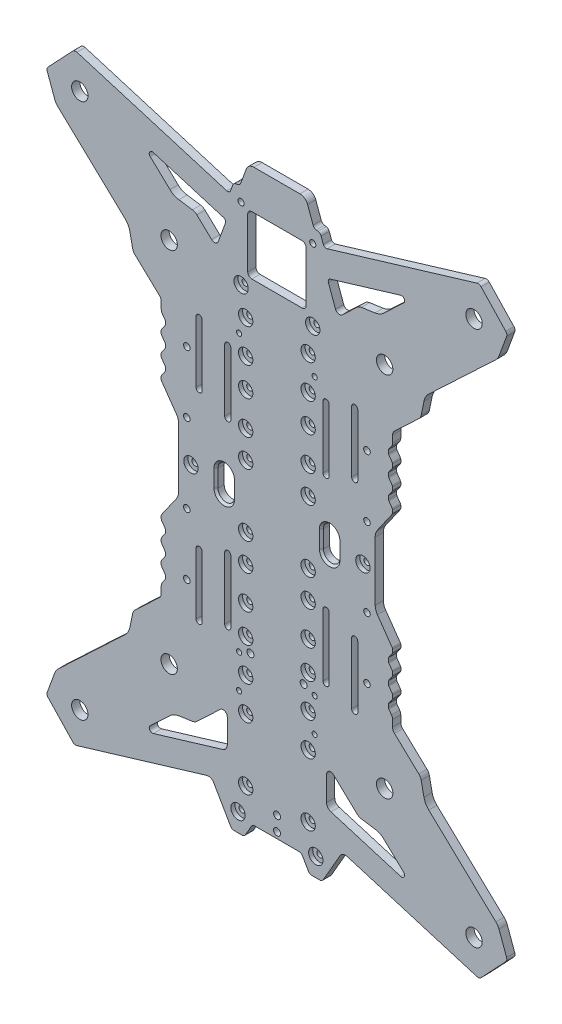
from build123d import *

# Parameters (mm, degrees)
MODEL_R                               = 1.5
MODEL_R_2                             = 4
MAIN_BODY_DEPTH                       = 4
LOWER_START                           = -2
SKETCH2_R                             = 3.5
SKETCH2_R_2                           = 1.5
LOWER_FIXTURE_POINT_COUNTERSINK_DEPTH = 2
EXTRA_BATTERY_STRAP_FIXTURES_REACH    = 419.565
BATTERY_CABLE_INGRESS_REACH           = 419.565
BATTERY_CABLE_INGRESS_CHAMFER_SIZE    = 1
MAUCH_PL200_MOUNTING_POINTS_REACH     = 419.565
SKETCH5_R                             = 1.25
RFD_CARRIER_MOUNTING_POINTS_REACH     = 419.565
SKETCH6_R                             = 1.700000001
ESC_CARRIER_FIXTURES_POINTS_REACH     = 419.565
SKETCH7_R                             = 1.6


with BuildPart() as part:
    # Model → Main Body (new body)
    with BuildSketch(Plane.XY):
        with BuildLine():
            Line((261.034392191, 314.782999023), (273.061648382, 302.032656534))
            ThreePointArc((273.061648382, 302.032656534), (273.565856978, 301.062828157), (273.484893514, 299.972764714))
            Line((273.484893514, 299.972764714), (269.784614814, 289.86483769))
            ThreePointArc((269.784614814, 289.86483769), (269.160003791, 288.625512695), (268.26736368, 287.562846704))
            Line((268.26736368, 287.562846704), (235.488392783, 256.642773314))
            ThreePointArc((235.488392783, 256.642773314), (233.992515204, 254.722726466), (233.143240584, 252.441726192))
            Line((233.143240584, 252.441726192), (231.792450322, 245.902694328))
            ThreePointArc((231.792450322, 245.902694328), (231.367815262, 244.762192559), (230.619877947, 243.802167042))
            Line((230.619877947, 243.802167042), (218.752224369, 232.607528134))
            ThreePointArc((218.752224369, 232.607528134), (218.056165205, 231.613589887), (217.810761554, 230.425234451))
            Line((217.810761554, 230.425234451), (217.810761554, 227.216127826))
            ThreePointArc((217.810761554, 227.216127826), (217.671912001, 226.314011906), (217.268217725, 225.495401336))
            Line((217.268217725, 225.495401336), (215.991609169, 223.672214462))
            ThreePointArc((215.991609169, 223.672214462), (215.857044411, 223.399344272), (215.810761226, 223.098638965))
            Line((215.810761226, 223.098638965), (215.810761226, 221.729233427))
            ThreePointArc((215.810761226, 221.729233427), (215.857044411, 221.428528121), (215.991609169, 221.155657931))
            Line((215.991609169, 221.155657931), (217.629913611, 218.815918578))
            ThreePointArc((217.629913611, 218.815918578), (217.76447837, 218.543048389), (217.810761554, 218.242343082))
            Line((217.810761554, 218.242343082), (217.810761554, 216.872937544))
            ThreePointArc((217.810761554, 216.872937544), (217.76447837, 216.572232237), (217.629913611, 216.299362047))
            Line((217.629913611, 216.299362047), (215.991609169, 213.959622695))
            ThreePointArc((215.991609169, 213.959622695), (215.857044411, 213.686752505), (215.810761226, 213.386047198))
            Line((215.810761226, 213.386047198), (215.810761226, 212.01664166))
            ThreePointArc((215.810761226, 212.01664166), (215.857044411, 211.715936353), (215.991609169, 211.443066163))
            Line((215.991609169, 211.443066163), (217.629913611, 209.103326811))
            ThreePointArc((217.629913611, 209.103326811), (217.76447837, 208.830456621), (217.810761554, 208.529751314))
            Line((217.810761554, 208.529751314), (217.810761554, 207.160345777))
            ThreePointArc((217.810761554, 207.160345777), (217.76447837, 206.85964047), (217.629913611, 206.58677028))
            Line((217.629913611, 206.58677028), (215.991609169, 204.247030927))
            ThreePointArc((215.991609169, 204.247030927), (215.85704385, 203.974158961), (215.810761226, 203.673451705))
            Line((215.810761226, 203.673451705), (215.810761226, 202.304049893))
            ThreePointArc((215.810761226, 202.304049893), (215.857044411, 202.003344586), (215.991609169, 201.730474396))
            Line((215.991609169, 201.730474396), (217.629913611, 199.390733181))
            ThreePointArc((217.629913611, 199.390733181), (217.76447837, 199.117862991), (217.810761554, 198.817157684))
            Line((217.810761554, 198.817157684), (217.810761554, 197.447755872))
            ThreePointArc((217.810761554, 197.447755872), (217.76447865, 197.147049591), (217.629913611, 196.874178513))
            Line((217.629913611, 196.874178513), (210.395850612, 186.542864455))
            ThreePointArc((210.395850612, 186.542864455), (209.588461221, 184.905640652), (209.310762955, 183.101405887))
            Line((209.310762955, 183.101405887), (209.310762955, 154.232495962))
            ThreePointArc((209.310762955, 154.232495962), (209.588461221, 152.428261198), (210.395850612, 150.791037394))
            Line((210.395850612, 150.791037394), (217.629913611, 140.459723337))
            ThreePointArc((217.629913611, 140.459723337), (217.76447865, 140.186852259), (217.810761554, 139.886145978))
            Line((217.810761554, 139.886145978), (217.810761554, 138.516744165))
            ThreePointArc((217.810761554, 138.516744165), (217.76447837, 138.216038858), (217.629913611, 137.943168669))
            Line((217.629913611, 137.943168669), (215.991609169, 135.603427453))
            ThreePointArc((215.991609169, 135.603427453), (215.857044411, 135.330557264), (215.810761226, 135.029851957))
            Line((215.810761226, 135.029851957), (215.810761226, 133.660450144))
            ThreePointArc((215.810761226, 133.660450144), (215.85704385, 133.359742889), (215.991609169, 133.086870922))
            Line((215.991609169, 133.086870922), (217.629913611, 130.74713157))
            ThreePointArc((217.629913611, 130.74713157), (217.76447837, 130.47426138), (217.810761554, 130.173556073))
            Line((217.810761554, 130.173556073), (217.810761554, 128.804150535))
            ThreePointArc((217.810761554, 128.804150535), (217.76447837, 128.503445228), (217.629913611, 128.230575039))
            Line((217.629913611, 128.230575039), (215.991609169, 125.890835686))
            ThreePointArc((215.991609169, 125.890835686), (215.857044411, 125.617965496), (215.810761226, 125.31726019))
            Line((215.810761226, 125.31726019), (215.810761226, 123.947854652))
            ThreePointArc((215.810761226, 123.947854652), (215.857044411, 123.647149345), (215.991609169, 123.374279155))
            Line((215.991609169, 123.374279155), (217.629913611, 121.034539803))
            ThreePointArc((217.629913611, 121.034539803), (217.76447837, 120.761669613), (217.810761554, 120.460964306))
            Line((217.810761554, 120.460964306), (217.810761554, 119.091558768))
            ThreePointArc((217.810761554, 119.091558768), (217.76447837, 118.790853461), (217.629913611, 118.517983271))
            Line((217.629913611, 118.517983271), (215.991609169, 116.178243919))
            ThreePointArc((215.991609169, 116.178243919), (215.857044411, 115.905373729), (215.810761226, 115.604668422))
            Line((215.810761226, 115.604668422), (215.810761226, 114.235262884))
            ThreePointArc((215.810761226, 114.235262884), (215.857044411, 113.934557578), (215.991609169, 113.661687388))
            Line((215.991609169, 113.661687388), (217.268217725, 111.838500513))
            ThreePointArc((217.268217725, 111.838500513), (217.671912001, 111.019889944), (217.810761554, 110.117774023))
            Line((217.810761554, 110.117774023), (217.810761554, 106.908667399))
            ThreePointArc((217.810761554, 106.908667399), (218.056165205, 105.720311962), (218.752224369, 104.726373716))
            Line((218.752224369, 104.726373716), (230.619877947, 93.531734808))
            ThreePointArc((230.619877947, 93.531734808), (231.367815262, 92.571709291), (231.792450322, 91.431207521))
            Line((231.792450322, 91.431207521), (233.143240584, 84.892175658))
            ThreePointArc((233.143240584, 84.892175658), (233.992515204, 82.611175384), (235.488392783, 80.691128536))
            Line((235.488392783, 80.691128536), (268.26736368, 49.771055146))
            ThreePointArc((268.26736368, 49.771055146), (269.160003791, 48.708389155), (269.784614814, 47.46906416))
            Line((269.784614814, 47.46906416), (273.484893514, 37.361137136))
            ThreePointArc((273.484893514, 37.361137136), (273.565856978, 36.271073693), (273.061648382, 35.301245315))
            Line((273.061648382, 35.301245315), (261.034392191, 22.550902827))
            ThreePointArc((261.034392191, 22.550902827), (260.095615458, 21.990999971), (259.002685917, 22.008262141))
            Line((259.002685917, 22.008262141), (195.639953388, 41.094414456))
            ThreePointArc((195.639953388, 41.094414456), (193.669430203, 41.010883841), (192.17661619, 39.721913202))
            Line((192.17661619, 39.721913202), (183.941960705, 25.45907305))
            ThreePointArc((183.941960705, 25.45907305), (183.209910003, 24.727020953), (182.209909333, 24.459071024))
            Line((182.209909333, 24.459071024), (178.411616383, 24.459071024))
            ThreePointArc((178.411616383, 24.459071024), (177.411615713, 24.727020953), (176.67956501, 25.45907305))
            Line((176.67956501, 25.45907305), (173.792813344, 30.459068282))
            ThreePointArc((173.792813344, 30.459068282), (173.060763045, 31.191120147), (172.060762902, 31.459070309))
            Line((172.060762902, 31.459070309), (150.560762172, 31.459070309))
            ThreePointArc((150.560762172, 31.459070309), (149.56076203, 31.191120147), (148.828711731, 30.459068282))
            Line((148.828711731, 30.459068282), (145.941960064, 25.45907305))
            ThreePointArc((145.941960064, 25.45907305), (145.209909362, 24.727020953), (144.209908692, 24.459071024))
            Line((144.209908692, 24.459071024), (140.411615742, 24.459071024))
            ThreePointArc((140.411615742, 24.459071024), (139.411615072, 24.727020953), (138.67956437, 25.45907305))
            Line((138.67956437, 25.45907305), (130.444908885, 39.721913202))
            ThreePointArc((130.444908885, 39.721913202), (128.952094872, 41.010883841), (126.981571687, 41.094414456))
            Line((126.981571687, 41.094414456), (63.618839157, 22.008262141))
            ThreePointArc((63.618839157, 22.008262141), (62.525909617, 21.990999971), (61.587132884, 22.550902827))
            Line((61.587132884, 22.550902827), (49.559876693, 35.301245315))
            ThreePointArc((49.559876693, 35.301245315), (49.055668097, 36.271073693), (49.136631561, 37.361137136))
            Line((49.136631561, 37.361137136), (52.836910261, 47.46906416))
            ThreePointArc((52.836910261, 47.46906416), (53.461521284, 48.708389155), (54.354161394, 49.771055146))
            Line((54.354161394, 49.771055146), (87.133132292, 80.691128536))
            ThreePointArc((87.133132292, 80.691128536), (88.629009871, 82.611175384), (89.478284491, 84.892175658))
            Line((89.478284491, 84.892175658), (90.829074753, 91.431207521))
            ThreePointArc((90.829074753, 91.431207521), (91.253709813, 92.571709291), (92.001647128, 93.531734808))
            Line((92.001647128, 93.531734808), (103.869300706, 104.726373716))
            ThreePointArc((103.869300706, 104.726373716), (104.565359869, 105.720311962), (104.810763521, 106.908667399))
            Line((104.810763521, 106.908667399), (104.810763521, 110.117774023))
            ThreePointArc((104.810763521, 110.117774023), (104.949613074, 111.019889944), (105.353307349, 111.838500513))
            Line((105.353307349, 111.838500513), (106.629915906, 113.661687388))
            ThreePointArc((106.629915906, 113.661687388), (106.764480664, 113.934557578), (106.810763849, 114.235262884))
            Line((106.810763849, 114.235262884), (106.810763849, 115.604668422))
            ThreePointArc((106.810763849, 115.604668422), (106.764480664, 115.905373729), (106.629915906, 116.178243919))
            Line((106.629915906, 116.178243919), (104.991611464, 118.517983271))
            ThreePointArc((104.991611464, 118.517983271), (104.857046705, 118.790853461), (104.810763521, 119.091558768))
            Line((104.810763521, 119.091558768), (104.810763521, 120.460964306))
            ThreePointArc((104.810763521, 120.460964306), (104.857046705, 120.761669613), (104.991611464, 121.034539803))
            Line((104.991611464, 121.034539803), (106.629915906, 123.374279155))
            ThreePointArc((106.629915906, 123.374279155), (106.764480664, 123.647149345), (106.810763849, 123.947854652))
            Line((106.810763849, 123.947854652), (106.810763849, 125.31726019))
            ThreePointArc((106.810763849, 125.31726019), (106.764480664, 125.617965496), (106.629915906, 125.890835686))
            Line((106.629915906, 125.890835686), (104.991611464, 128.230575039))
            ThreePointArc((104.991611464, 128.230575039), (104.857046705, 128.503445229), (104.810763521, 128.804150535))
            Line((104.810763521, 128.804150535), (104.810763521, 130.173556073))
            ThreePointArc((104.810763521, 130.173556073), (104.857046705, 130.47426138), (104.991611464, 130.74713157))
            Line((104.991611464, 130.74713157), (106.629915906, 133.086870922))
            ThreePointArc((106.629915906, 133.086870922), (106.764481224, 133.359742889), (106.810763849, 133.660450144))
            Line((106.810763849, 133.660450144), (106.810763849, 135.029851957))
            ThreePointArc((106.810763849, 135.029851957), (106.764480664, 135.330557264), (106.629915906, 135.603427453))
            Line((106.629915906, 135.603427453), (104.991611464, 137.943168669))
            ThreePointArc((104.991611464, 137.943168669), (104.857046705, 138.216038858), (104.810763521, 138.516744165))
            Line((104.810763521, 138.516744165), (104.810763521, 139.886145978))
            ThreePointArc((104.810763521, 139.886145978), (104.857046425, 140.186852259), (104.991611464, 140.459723337))
            Line((104.991611464, 140.459723337), (112.225674463, 150.791037394))
            ThreePointArc((112.225674463, 150.791037394), (113.033063854, 152.428261198), (113.31076212, 154.232495962))
            Line((113.31076212, 154.232495962), (113.31076212, 183.101405887))
            ThreePointArc((113.31076212, 183.101405887), (113.033063854, 184.905640652), (112.225674463, 186.542864455))
            Line((112.225674463, 186.542864455), (104.991611464, 196.874178513))
            ThreePointArc((104.991611464, 196.874178513), (104.857046425, 197.147049591), (104.810763521, 197.447755872))
            Line((104.810763521, 197.447755872), (104.810763521, 198.817157684))
            ThreePointArc((104.810763521, 198.817157684), (104.857046705, 199.117862991), (104.991611464, 199.390733181))
            Line((104.991611464, 199.390733181), (106.629915906, 201.730474396))
            ThreePointArc((106.629915906, 201.730474396), (106.764480664, 202.003344586), (106.810763849, 202.304049893))
            Line((106.810763849, 202.304049893), (106.810763849, 203.673451705))
            ThreePointArc((106.810763849, 203.673451705), (106.764481224, 203.974158961), (106.629915906, 204.247030927))
            Line((106.629915906, 204.247030927), (104.991611464, 206.58677028))
            ThreePointArc((104.991611464, 206.58677028), (104.857046705, 206.85964047), (104.810763521, 207.160345777))
            Line((104.810763521, 207.160345777), (104.810763521, 208.529751314))
            ThreePointArc((104.810763521, 208.529751314), (104.857046705, 208.830456621), (104.991611464, 209.103326811))
            Line((104.991611464, 209.103326811), (106.629915906, 211.443066163))
            ThreePointArc((106.629915906, 211.443066163), (106.764480664, 211.715936353), (106.810763849, 212.01664166))
            Line((106.810763849, 212.01664166), (106.810763849, 213.386047198))
            ThreePointArc((106.810763849, 213.386047198), (106.764480664, 213.686752505), (106.629915906, 213.959622695))
            Line((106.629915906, 213.959622695), (104.991611464, 216.299362047))
            ThreePointArc((104.991611464, 216.299362047), (104.857046705, 216.572232237), (104.810763521, 216.872937544))
            Line((104.810763521, 216.872937544), (104.810763521, 218.242343082))
            ThreePointArc((104.810763521, 218.242343082), (104.857046705, 218.543048389), (104.991611464, 218.815918578))
            Line((104.991611464, 218.815918578), (106.629915906, 221.155657931))
            ThreePointArc((106.629915906, 221.155657931), (106.764480664, 221.428528121), (106.810763849, 221.729233427))
            Line((106.810763849, 221.729233427), (106.810763849, 223.098638965))
            ThreePointArc((106.810763849, 223.098638965), (106.764480664, 223.399344272), (106.629915906, 223.672214462))
            Line((106.629915906, 223.672214462), (105.353307349, 225.495401336))
            ThreePointArc((105.353307349, 225.495401336), (104.949613074, 226.314011906), (104.810763521, 227.216127826))
            Line((104.810763521, 227.216127826), (104.810763521, 230.425234451))
            ThreePointArc((104.810763521, 230.425234451), (104.565359869, 231.613589887), (103.869300706, 232.607528134))
            Line((103.869300706, 232.607528134), (92.001647128, 243.802167042))
            ThreePointArc((92.001647128, 243.802167042), (91.253709813, 244.762192559), (90.829074753, 245.902694328))
            Line((90.829074753, 245.902694328), (89.478284491, 252.441726192))
            ThreePointArc((89.478284491, 252.441726192), (88.629009871, 254.722726466), (87.133132292, 256.642773314))
            Line((87.133132292, 256.642773314), (54.354161394, 287.562846704))
            ThreePointArc((54.354161394, 287.562846704), (53.461521284, 288.625512695), (52.836910261, 289.86483769))
            Line((52.836910261, 289.86483769), (49.136631561, 299.972764714))
            ThreePointArc((49.136631561, 299.972764714), (49.055668097, 301.062828157), (49.559876693, 302.032656534))
            Line((49.559876693, 302.032656534), (61.587132884, 314.782999023))
            ThreePointArc((61.587132884, 314.782999023), (62.525909617, 315.342901879), (63.618839157, 315.325639708))
            Line((63.618839157, 315.325639708), (136.809913812, 293.278984292))
            ThreePointArc((136.809913812, 293.278984292), (137.914608643, 293.374219842), (138.652082903, 294.202200635))
            Line((138.652082903, 294.202200635), (139.728013796, 297.158307894))
            ThreePointArc((139.728013796, 297.158307894), (140.321825305, 298.006352282), (141.260102762, 298.443875773))
            Line((141.260102762, 298.443875773), (142.112970723, 298.594258292))
            ThreePointArc((142.112970723, 298.594258292), (143.051251128, 299.031788099), (143.645059688, 299.879841073))
            Line((143.645059688, 299.879841073), (146.325001864, 307.242922051))
            ThreePointArc((146.325001864, 307.242922051), (147.789467359, 309.151448821), (150.083773209, 309.874839647))
            Line((150.083773209, 309.874839647), (172.537751866, 309.874839647))
            ThreePointArc((172.537751866, 309.874839647), (174.832057716, 309.151448821), (176.296523211, 307.242922051))
            Line((176.296523211, 307.242922051), (178.976465387, 299.879841073))
            ThreePointArc((178.976465387, 299.879841073), (179.570273946, 299.031788099), (180.508554352, 298.594258292))
            Line((180.508554352, 298.594258292), (181.361422313, 298.443875773))
            ThreePointArc((181.361422313, 298.443875773), (182.29969977, 298.006352282), (182.893511278, 297.158307894))
            Line((182.893511278, 297.158307894), (183.969442172, 294.202200635))
            ThreePointArc((183.969442172, 294.202200635), (184.706916432, 293.374219842), (185.811611263, 293.278984292))
            Line((185.811611263, 293.278984292), (259.002685917, 315.325639708))
            ThreePointArc((259.002685917, 315.325639708), (260.095615458, 315.342901879), (261.034392191, 314.782999023))
        make_face()
        with Locations((178.810762537, 292.022001283)):
            Circle(MODEL_R, mode=Mode.SUBTRACT)
        with Locations((213.945462155, 258.31672503)):
            Circle(MODEL_R_2, mode=Mode.SUBTRACT)
        with Locations((257.591400323, 299.487492346)):
            Circle(MODEL_R_2, mode=Mode.SUBTRACT)
        with Locations((65.030124751, 299.487492346)):
            Circle(MODEL_R_2, mode=Mode.SUBTRACT)
        with Locations((108.67606292, 258.31672503)):
            Circle(MODEL_R_2, mode=Mode.SUBTRACT)
        with Locations((108.67606292, 79.017176819)):
            Circle(MODEL_R_2, mode=Mode.SUBTRACT)
        with Locations((65.030124751, 37.846409503)):
            Circle(MODEL_R_2, mode=Mode.SUBTRACT)
        with Locations((257.591400323, 37.846409503)):
            Circle(MODEL_R_2, mode=Mode.SUBTRACT)
        with Locations((213.945462155, 79.017176819)):
            Circle(MODEL_R_2, mode=Mode.SUBTRACT)
        with Locations((143.810762537, 292.022001283)):
            Circle(MODEL_R, mode=Mode.SUBTRACT)
        with Locations((176.560762537, 227.916950925)):
            Circle(MODEL_R, mode=Mode.SUBTRACT)
        with Locations((146.060762537, 227.916950925)):
            Circle(MODEL_R, mode=Mode.SUBTRACT)
        with Locations((146.060762537, 123.541950925)):
            Circle(MODEL_R, mode=Mode.SUBTRACT)
        with Locations((176.560762537, 123.541950925)):
            Circle(MODEL_R, mode=Mode.SUBTRACT)
        with Locations((146.060762537, 93.041950925)):
            Circle(MODEL_R, mode=Mode.SUBTRACT)
        with Locations((176.560762537, 93.041950925)):
            Circle(MODEL_R, mode=Mode.SUBTRACT)
        with Locations((180.310762537, 33.459065681)):
            Circle(MODEL_R, mode=Mode.SUBTRACT)
        with Locations((142.310762537, 33.459065681)):
            Circle(MODEL_R, mode=Mode.SUBTRACT)
        with Locations((176.560762537, 76.666950925)):
            Circle(MODEL_R, mode=Mode.SUBTRACT)
        with Locations((146.060762537, 76.666950925)):
            Circle(MODEL_R, mode=Mode.SUBTRACT)
        with Locations((146.060762537, 109.416950925)):
            Circle(MODEL_R, mode=Mode.SUBTRACT)
        with Locations((119.310762537, 168.666950925)):
            Circle(MODEL_R, mode=Mode.SUBTRACT)
        with Locations((176.560762537, 139.916950925)):
            Circle(MODEL_R, mode=Mode.SUBTRACT)
        with Locations((146.060762537, 139.916950925)):
            Circle(MODEL_R, mode=Mode.SUBTRACT)
        with Locations((146.060762537, 213.791950925)):
            Circle(MODEL_R, mode=Mode.SUBTRACT)
        with Locations((176.560762537, 213.791950925)):
            Circle(MODEL_R, mode=Mode.SUBTRACT)
        with Locations((176.560762537, 109.416950925)):
            Circle(MODEL_R, mode=Mode.SUBTRACT)
        with Locations((176.560762537, 197.416950925)):
            Circle(MODEL_R, mode=Mode.SUBTRACT)
        with Locations((176.560762537, 244.291950925)):
            Circle(MODEL_R, mode=Mode.SUBTRACT)
        with Locations((203.310762537, 168.666950925)):
            Circle(MODEL_R, mode=Mode.SUBTRACT)
        with Locations((143.810762537, 257.022001283)):
            Circle(MODEL_R, mode=Mode.SUBTRACT)
        with Locations((178.810762537, 257.022001283)):
            Circle(MODEL_R, mode=Mode.SUBTRACT)
        with Locations((146.060762537, 244.291950925)):
            Circle(MODEL_R, mode=Mode.SUBTRACT)
        with Locations((146.060762537, 46.166950925)):
            Circle(MODEL_R, mode=Mode.SUBTRACT)
        with Locations((146.060762537, 197.416950925)):
            Circle(MODEL_R, mode=Mode.SUBTRACT)
        with Locations((176.560762537, 46.166950925)):
            Circle(MODEL_R, mode=Mode.SUBTRACT)
        with Locations((146.060762537, 183.916950925)):
            Circle(MODEL_R, mode=Mode.SUBTRACT)
        with Locations((146.060762537, 153.416950925)):
            Circle(MODEL_R, mode=Mode.SUBTRACT)
        with Locations((176.560762537, 153.416950925)):
            Circle(MODEL_R, mode=Mode.SUBTRACT)
        with Locations((176.560762537, 183.916950925)):
            Circle(MODEL_R, mode=Mode.SUBTRACT)
        with BuildLine():
            Line((183.810763431, 197.416951446), (183.810763431, 227.916951789))
            ThreePointArc((183.810763431, 227.916951789), (185.310762746, 229.416951104), (186.810762061, 227.916951789))
            Line((186.810762061, 227.916951789), (186.810762061, 197.416951446))
            ThreePointArc((186.810762061, 197.416951446), (185.310762746, 195.916952132), (183.810763431, 197.416951446))
        make_face(mode=Mode.SUBTRACT)
        with BuildLine():
            Line((138.810761643, 139.916950403), (138.810761643, 109.416950061))
            ThreePointArc((138.810761643, 109.416950061), (137.310762329, 107.916950746), (135.810763014, 109.416950061))
            Line((135.810763014, 109.416950061), (135.810763014, 139.916950403))
            ThreePointArc((135.810763014, 139.916950403), (137.310762329, 141.416949718), (138.810761643, 139.916950403))
        make_face(mode=Mode.SUBTRACT)
        with BuildLine():
            Line((186.810762061, 139.916950403), (186.810762061, 109.416950061))
            ThreePointArc((186.810762061, 109.416950061), (185.310762746, 107.916950746), (183.810763431, 109.416950061))
            Line((183.810763431, 109.416950061), (183.810763431, 139.916950403))
            ThreePointArc((183.810763431, 139.916950403), (185.310762746, 141.416949718), (186.810762061, 139.916950403))
        make_face(mode=Mode.SUBTRACT)
        with BuildLine():
            Line((135.810763014, 197.416951446), (135.810763014, 227.916951789))
            ThreePointArc((135.810763014, 227.916951789), (137.310762329, 229.416951104), (138.810761643, 227.916951789))
            Line((138.810761643, 227.916951789), (138.810761643, 197.416951446))
            ThreePointArc((138.810761643, 197.416951446), (137.310762329, 195.916952132), (135.810763014, 197.416951446))
        make_face(mode=Mode.SUBTRACT)
        with BuildLine():
            Line((147.06076253, 264.094478949), (147.06076253, 288.594476445))
            ThreePointArc((147.06076253, 288.594476445), (147.646550285, 290.008687927), (149.060762858, 290.594473048))
            Line((149.060762858, 290.594473048), (173.560762217, 290.594473048))
            ThreePointArc((173.560762217, 290.594473048), (174.97497479, 290.008687927), (175.560762545, 288.594476445))
            Line((175.560762545, 288.594476445), (175.560762545, 264.094478949))
            ThreePointArc((175.560762545, 264.094478949), (174.974977424, 262.68026265), (173.560762217, 262.094474896))
            Line((173.560762217, 262.094474896), (149.060762858, 262.094474896))
            ThreePointArc((149.060762858, 262.094474896), (147.646547651, 262.68026265), (147.06076253, 264.094478949))
        make_face(mode=Mode.SUBTRACT)
        with BuildLine():
            Line((133.688403664, 72.367697521), (122.193541748, 61.524711116))
            ThreePointArc((122.193541748, 61.524711116), (121.191534815, 60.834033021), (120.028213037, 60.476630493))
            Line((120.028213037, 60.476630493), (113.421537353, 59.509470625))
            ThreePointArc((113.421537353, 59.509470625), (111.094892422, 58.79465859), (109.09087993, 57.413294478))
            Line((109.09087993, 57.413294478), (99.422797931, 48.293493255))
            ThreePointArc((99.422797931, 48.293493255), (99.153636079, 46.451307287), (100.884698702, 45.766092403))
            Line((100.884698702, 45.766092403), (134.92602147, 56.020035906))
            ThreePointArc((134.92602147, 56.020035906), (136.468642418, 57.103103666), (137.060761822, 58.892547651))
            Line((137.060761822, 58.892547651), (137.060761822, 70.912830098))
            ThreePointArc((137.060761822, 70.912830098), (135.85300129, 72.749229936), (133.688403664, 72.367697521))
        make_face(mode=Mode.SUBTRACT)
        with BuildLine():
            Line((209.199987722, 59.509470625), (202.593312038, 60.476630493))
            ThreePointArc((202.593312038, 60.476630493), (201.42999026, 60.834033021), (200.427983327, 61.524711116))
            Line((200.427983327, 61.524711116), (188.933121411, 72.367697521))
            ThreePointArc((188.933121411, 72.367697521), (186.768523785, 72.749229936), (185.560763253, 70.912830098))
            Line((185.560763253, 70.912830098), (185.560763253, 58.892547651))
            ThreePointArc((185.560763253, 58.892547651), (186.152882656, 57.103103666), (187.695503605, 56.020035906))
            Line((187.695503605, 56.020035906), (221.736826373, 45.766092403))
            ThreePointArc((221.736826373, 45.766092403), (223.467888996, 46.451307287), (223.198727144, 48.293493255))
            Line((223.198727144, 48.293493255), (213.530645145, 57.413294478))
            ThreePointArc((213.530645145, 57.413294478), (211.526632653, 58.79465859), (209.199987722, 59.509470625))
        make_face(mode=Mode.SUBTRACT)
        with BuildLine():
            Line((113.421537353, 277.824431224), (120.028213037, 276.857271357))
            ThreePointArc((120.028213037, 276.857271357), (121.191534815, 276.499868829), (122.193541748, 275.809190734))
            Line((122.193541748, 275.809190734), (129.428796841, 268.98424284))
            ThreePointArc((129.428796841, 268.98424284), (131.262472413, 268.49303928), (132.680541275, 269.755072458))
            Line((132.680541275, 269.755072458), (136.150926722, 279.289878471))
            ThreePointArc((136.150926722, 279.289878471), (136.082401816, 280.474972249), (135.17401777, 281.239158972))
            Line((135.17401777, 281.239158972), (100.884698702, 291.567809446))
            ThreePointArc((100.884698702, 291.567809446), (99.153636079, 290.882594562), (99.422797931, 289.040408595))
            Line((99.422797931, 289.040408595), (109.09087993, 279.920607372))
            ThreePointArc((109.09087993, 279.920607372), (111.094892422, 278.539243259), (113.421537353, 277.824431224))
        make_face(mode=Mode.SUBTRACT)
        with BuildLine():
            Line((193.192728234, 268.98424284), (200.427983327, 275.809190734))
            ThreePointArc((200.427983327, 275.809190734), (201.42999026, 276.499868829), (202.593312038, 276.857271357))
            Line((202.593312038, 276.857271357), (209.199987722, 277.824431224))
            ThreePointArc((209.199987722, 277.824431224), (211.526632653, 278.539243259), (213.530645145, 279.920607372))
            Line((213.530645145, 279.920607372), (223.198727144, 289.040408595))
            ThreePointArc((223.198727144, 289.040408595), (223.467888996, 290.882594562), (221.736826373, 291.567809446))
            Line((221.736826373, 291.567809446), (187.447507305, 281.239158972))
            ThreePointArc((187.447507305, 281.239158972), (186.539123259, 280.474972249), (186.470598353, 279.289878471))
            Line((186.470598353, 279.289878471), (189.9409838, 269.755072458))
            ThreePointArc((189.9409838, 269.755072458), (191.359052662, 268.49303928), (193.192728234, 268.98424284))
        make_face(mode=Mode.SUBTRACT)
    extrude(amount=MAIN_BODY_DEPTH)

    # Sketch2 → Lower Fixture Point Countersink (cut)
    # profile 1 of 30: a face of its own
    with BuildSketch(Plane.XY.offset(4).offset(LOWER_START)):
        with Locations((176.560762537, 46.166950925)):
            Circle(SKETCH2_R)
    # profile 2 of 30: a face of its own
    with BuildSketch(Plane.XY.offset(4).offset(LOWER_START)):
        with Locations((180.310762537, 33.459065681)):
            Circle(SKETCH2_R)
    # profile 3 of 30: a face of its own
    with BuildSketch(Plane.XY.offset(4).offset(LOWER_START)):
        with Locations((142.310762537, 33.459065681)):
            Circle(SKETCH2_R)
    # profile 4 of 30: a face of its own
    with BuildSketch(Plane.XY.offset(4).offset(LOWER_START)):
        with Locations((146.060762537, 46.166950925)):
            Circle(SKETCH2_R)
    # profile 5 of 30: a face of its own
    with BuildSketch(Plane.XY.offset(4).offset(LOWER_START)):
        with Locations((176.560762537, 76.666950925)):
            Circle(SKETCH2_R)
    # profile 6 of 30: a face of its own
    with BuildSketch(Plane.XY.offset(4).offset(LOWER_START)):
        with Locations((146.060762537, 76.666950925)):
            Circle(SKETCH2_R)
    # profile 7 of 30: a face of its own
    with BuildSketch(Plane.XY.offset(4).offset(LOWER_START)):
        with Locations((146.060762537, 93.041950925)):
            Circle(SKETCH2_R)
    # profile 8 of 30: a face of its own
    with BuildSketch(Plane.XY.offset(4).offset(LOWER_START)):
        with Locations((176.560762537, 93.041950925)):
            Circle(SKETCH2_R)
    # profile 9 of 30: a face of its own
    with BuildSketch(Plane.XY.offset(4).offset(LOWER_START)):
        with Locations((176.560762537, 109.416950925)):
            Circle(SKETCH2_R)
    # profile 10 of 30: a face of its own
    with BuildSketch(Plane.XY.offset(4).offset(LOWER_START)):
        with Locations((146.060762537, 109.416950925)):
            Circle(SKETCH2_R)
    # profile 11 of 30: a face of its own
    with BuildSketch(Plane.XY.offset(4).offset(LOWER_START)):
        with Locations((176.560762537, 123.541950925)):
            Circle(SKETCH2_R)
    # profile 12 of 30: a face of its own
    with BuildSketch(Plane.XY.offset(4).offset(LOWER_START)):
        with Locations((146.060762537, 123.541950925)):
            Circle(SKETCH2_R)
    # profile 13 of 30: a face of its own
    with BuildSketch(Plane.XY.offset(4).offset(LOWER_START)):
        with Locations((146.060762537, 139.916950925)):
            Circle(SKETCH2_R)
    # profile 14 of 30: a face of its own
    with BuildSketch(Plane.XY.offset(4).offset(LOWER_START)):
        with Locations((176.560762537, 139.916950925)):
            Circle(SKETCH2_R)
        with Locations((176.560762537, 139.916950925)):
            Circle(SKETCH2_R_2, mode=Mode.SUBTRACT)
    # profile 15 of 30: a face of its own
    with BuildSketch(Plane.XY.offset(4).offset(LOWER_START)):
        with Locations((203.310762537, 168.666950925)):
            Circle(SKETCH2_R)
    # profile 16 of 30: a face of its own
    with BuildSketch(Plane.XY.offset(4).offset(LOWER_START)):
        with Locations((176.560762537, 153.416950925)):
            Circle(SKETCH2_R)
    # profile 17 of 30: a face of its own
    with BuildSketch(Plane.XY.offset(4).offset(LOWER_START)):
        with Locations((146.060762537, 153.416950925)):
            Circle(SKETCH2_R)
    # profile 18 of 30: a face of its own
    with BuildSketch(Plane.XY.offset(4).offset(LOWER_START)):
        with Locations((119.310762537, 168.666950925)):
            Circle(SKETCH2_R)
    # profile 19 of 30: a face of its own
    with BuildSketch(Plane.XY.offset(4).offset(LOWER_START)):
        with Locations((146.060762537, 183.916950925)):
            Circle(SKETCH2_R)
    # profile 20 of 30: a face of its own
    with BuildSketch(Plane.XY.offset(4).offset(LOWER_START)):
        with Locations((176.560762537, 183.916950925)):
            Circle(SKETCH2_R)
    # profile 21 of 30: a face of its own
    with BuildSketch(Plane.XY.offset(4).offset(LOWER_START)):
        with Locations((176.560762537, 197.416950925)):
            Circle(SKETCH2_R)
    # profile 22 of 30: a face of its own
    with BuildSketch(Plane.XY.offset(4).offset(LOWER_START)):
        with Locations((146.060762537, 197.416950925)):
            Circle(SKETCH2_R)
    # profile 23 of 30: a face of its own
    with BuildSketch(Plane.XY.offset(4).offset(LOWER_START)):
        with Locations((176.560762537, 213.791950925)):
            Circle(SKETCH2_R)
    # profile 24 of 30: a face of its own
    with BuildSketch(Plane.XY.offset(4).offset(LOWER_START)):
        with Locations((146.060762537, 213.791950925)):
            Circle(SKETCH2_R)
    # profile 25 of 30: a face of its own
    with BuildSketch(Plane.XY.offset(4).offset(LOWER_START)):
        with Locations((146.060762537, 227.916950925)):
            Circle(SKETCH2_R)
    # profile 26 of 30: a face of its own
    with BuildSketch(Plane.XY.offset(4).offset(LOWER_START)):
        with Locations((176.560762537, 227.916950925)):
            Circle(SKETCH2_R)
    # profile 27 of 30: a face of its own
    with BuildSketch(Plane.XY.offset(4).offset(LOWER_START)):
        with Locations((176.560762537, 244.291950925)):
            Circle(SKETCH2_R)
    # profile 28 of 30: a face of its own
    with BuildSketch(Plane.XY.offset(4).offset(LOWER_START)):
        with Locations((178.810762537, 257.022001283)):
            Circle(SKETCH2_R)
    # profile 29 of 30: a face of its own
    with BuildSketch(Plane.XY.offset(4).offset(LOWER_START)):
        with Locations((146.060762537, 244.291950925)):
            Circle(SKETCH2_R)
    # profile 30 of 30: a face of its own
    with BuildSketch(Plane.XY.offset(4).offset(LOWER_START)):
        with Locations((143.810762537, 257.022001283)):
            Circle(SKETCH2_R)
    extrude(amount=LOWER_FIXTURE_POINT_COUNTERSINK_DEPTH, mode=Mode.SUBTRACT)

    # Sketch3 → Extra Battery Strap Fixtures (cut, up to next)
    with BuildSketch(Plane(origin=(0, 0, 0), x_dir=(-1, 0, 0), z_dir=(0, 0, -1)), mode=Mode.PRIVATE) as extra_battery_strap_fixtures_sk1:
        with BuildLine():
            Line((-124.810763074, 134.666949077), (-124.810763074, 104.666947885))
            ThreePointArc((-124.810763074, 104.666947885), (-123.310761897, 103.166946708), (-121.81076072, 104.666947885))
            Line((-121.81076072, 104.666947885), (-121.81076072, 134.666949077))
            ThreePointArc((-121.81076072, 134.666949077), (-123.310761897, 136.166950254), (-124.810763074, 134.666949077))
        make_face()
    extra_battery_strap_fixtures_tool1 = extrude(extra_battery_strap_fixtures_sk1.sketch, amount=-EXTRA_BATTERY_STRAP_FIXTURES_REACH, mode=Mode.PRIVATE) & part.part
    # Sketch3 → Extra Battery Strap Fixtures (cut, up to next)
    with BuildSketch(Plane(origin=(0, 0, 0), x_dir=(-1, 0, 0), z_dir=(0, 0, -1)), mode=Mode.PRIVATE) as extra_battery_strap_fixtures_sk2:
        with BuildLine():
            Line((-124.810763074, 232.666953965), (-124.810763074, 202.666952773))
            ThreePointArc((-124.810763074, 202.666952773), (-123.310761897, 201.166951595), (-121.81076072, 202.666952773))
            Line((-121.81076072, 202.666952773), (-121.81076072, 232.666953965))
            ThreePointArc((-121.81076072, 232.666953965), (-123.310761897, 234.166955142), (-124.810763074, 232.666953965))
        make_face()
    extra_battery_strap_fixtures_tool2 = extrude(extra_battery_strap_fixtures_sk2.sketch, amount=-EXTRA_BATTERY_STRAP_FIXTURES_REACH, mode=Mode.PRIVATE) & part.part
    # Sketch3 → Extra Battery Strap Fixtures (cut, up to next)
    with BuildSketch(Plane(origin=(0, 0, 0), x_dir=(-1, 0, 0), z_dir=(0, 0, -1)), mode=Mode.PRIVATE) as extra_battery_strap_fixtures_sk3:
        with BuildLine():
            Line((-200.810764355, 232.666953965), (-200.810764355, 202.666952773))
            ThreePointArc((-200.810764355, 202.666952773), (-199.310763178, 201.166951595), (-197.810762001, 202.666952773))
            Line((-197.810762001, 202.666952773), (-197.810762001, 232.666953965))
            ThreePointArc((-197.810762001, 232.666953965), (-199.310763178, 234.166955142), (-200.810764355, 232.666953965))
        make_face()
    extra_battery_strap_fixtures_tool3 = extrude(extra_battery_strap_fixtures_sk3.sketch, amount=-EXTRA_BATTERY_STRAP_FIXTURES_REACH, mode=Mode.PRIVATE) & part.part
    # Sketch3 → Extra Battery Strap Fixtures (cut, up to next)
    with BuildSketch(Plane(origin=(0, 0, 0), x_dir=(-1, 0, 0), z_dir=(0, 0, -1)), mode=Mode.PRIVATE) as extra_battery_strap_fixtures_sk4:
        with BuildLine():
            Line((-197.810762001, 104.666947885), (-197.810762001, 134.666949077))
            ThreePointArc((-197.810762001, 134.666949077), (-199.310763178, 136.166950254), (-200.810764355, 134.666949077))
            Line((-200.810764355, 134.666949077), (-200.810764355, 104.666947885))
            ThreePointArc((-200.810764355, 104.666947885), (-199.310763178, 103.166946708), (-197.810762001, 104.666947885))
        make_face()
    extra_battery_strap_fixtures_tool4 = extrude(extra_battery_strap_fixtures_sk4.sketch, amount=-EXTRA_BATTERY_STRAP_FIXTURES_REACH, mode=Mode.PRIVATE) & part.part
    add(extra_battery_strap_fixtures_tool1.solids().sort_by_distance((123.310762, 119.666948, 0))[0], mode=Mode.SUBTRACT)
    add(extra_battery_strap_fixtures_tool2.solids().sort_by_distance((123.310762, 217.666953, 0))[0], mode=Mode.SUBTRACT)
    add(extra_battery_strap_fixtures_tool3.solids().sort_by_distance((199.310763, 217.666953, 0))[0], mode=Mode.SUBTRACT)
    add(extra_battery_strap_fixtures_tool4.solids().sort_by_distance((199.310763, 119.666948, 0))[0], mode=Mode.SUBTRACT)

    # Sketch4 → Battery Cable Ingress (cut, up to next)
    with BuildSketch(Plane(origin=(0, 0, 0), x_dir=(-1, 0, 0), z_dir=(0, 0, -1)), mode=Mode.PRIVATE) as battery_cable_ingress_sk1:
        with BuildLine():
            Line((-191.060763257, 164.416950065), (-191.060763257, 172.916950065))
            ThreePointArc((-191.060763257, 172.916950065), (-187.060763257, 176.916950065), (-183.060763257, 172.916950065))
            Line((-183.060763257, 172.916950065), (-183.060763257, 164.416950065))
            ThreePointArc((-183.060763257, 164.416950065), (-187.060763257, 160.416950065), (-191.060763257, 164.416950065))
        make_face()
    battery_cable_ingress_tool1 = extrude(battery_cable_ingress_sk1.sketch, amount=-BATTERY_CABLE_INGRESS_REACH, mode=Mode.PRIVATE) & part.part
    # Sketch4 → Battery Cable Ingress (cut, up to next)
    with BuildSketch(Plane(origin=(0, 0, 0), x_dir=(-1, 0, 0), z_dir=(0, 0, -1)), mode=Mode.PRIVATE) as battery_cable_ingress_sk2:
        with BuildLine():
            Line((-131.560763257, 172.916950065), (-131.560763257, 164.416950065))
            ThreePointArc((-131.560763257, 164.416950065), (-135.560763257, 160.416950065), (-139.560763257, 164.416950065))
            Line((-139.560763257, 164.416950065), (-139.560763257, 172.916950065))
            ThreePointArc((-139.560763257, 172.916950065), (-135.560763257, 176.916950065), (-131.560763257, 172.916950065))
        make_face()
    battery_cable_ingress_tool2 = extrude(battery_cable_ingress_sk2.sketch, amount=-BATTERY_CABLE_INGRESS_REACH, mode=Mode.PRIVATE) & part.part
    add(battery_cable_ingress_tool1.solids().sort_by_distance((187.060763, 168.66695, 0))[0], mode=Mode.SUBTRACT)
    add(battery_cable_ingress_tool2.solids().sort_by_distance((135.560763, 168.66695, 0))[0], mode=Mode.SUBTRACT)

    # Battery Cable Ingress Chamfer
    battery_cable_ingress_chamfer_edges = [part.edges().sort_by_distance(p)[0] for p in [
        (131.560763257, 168.666950065, 4),
        (139.560763257, 168.666950065, 4),
        (183.060763257, 168.666950065, 4),
        (191.060763257, 168.666950065, 4),
    ]]
    chamfer(battery_cable_ingress_chamfer_edges, length=BATTERY_CABLE_INGRESS_CHAMFER_SIZE)

    # Sketch5 → Mauch PL200 Mounting Points (cut, up to next)
    with BuildSketch(Plane(origin=(0, 0, 0), x_dir=(-1, 0, 0), z_dir=(0, 0, -1)), mode=Mode.PRIVATE) as mauch_pl200_mounting_points_sk1:
        with Locations((-142.860762537, 84.854450925)):
            Circle(SKETCH5_R)
    mauch_pl200_mounting_points_tool1 = extrude(mauch_pl200_mounting_points_sk1.sketch, amount=-MAUCH_PL200_MOUNTING_POINTS_REACH, mode=Mode.PRIVATE) & part.part
    # Sketch5 → Mauch PL200 Mounting Points (cut, up to next)
    with BuildSketch(Plane(origin=(0, 0, 0), x_dir=(-1, 0, 0), z_dir=(0, 0, -1)), mode=Mode.PRIVATE) as mauch_pl200_mounting_points_sk2:
        with Locations((-142.860762537, 101.229450925)):
            Circle(SKETCH5_R)
    mauch_pl200_mounting_points_tool2 = extrude(mauch_pl200_mounting_points_sk2.sketch, amount=-MAUCH_PL200_MOUNTING_POINTS_REACH, mode=Mode.PRIVATE) & part.part
    # Sketch5 → Mauch PL200 Mounting Points (cut, up to next)
    with BuildSketch(Plane(origin=(0, 0, 0), x_dir=(-1, 0, 0), z_dir=(0, 0, -1)), mode=Mode.PRIVATE) as mauch_pl200_mounting_points_sk3:
        with Locations((-142.860762537, 236.104450925)):
            Circle(SKETCH5_R)
    mauch_pl200_mounting_points_tool3 = extrude(mauch_pl200_mounting_points_sk3.sketch, amount=-MAUCH_PL200_MOUNTING_POINTS_REACH, mode=Mode.PRIVATE) & part.part
    # Sketch5 → Mauch PL200 Mounting Points (cut, up to next)
    with BuildSketch(Plane(origin=(0, 0, 0), x_dir=(-1, 0, 0), z_dir=(0, 0, -1)), mode=Mode.PRIVATE) as mauch_pl200_mounting_points_sk4:
        with Locations((-179.760762537, 236.104450925)):
            Circle(SKETCH5_R)
    mauch_pl200_mounting_points_tool4 = extrude(mauch_pl200_mounting_points_sk4.sketch, amount=-MAUCH_PL200_MOUNTING_POINTS_REACH, mode=Mode.PRIVATE) & part.part
    # Sketch5 → Mauch PL200 Mounting Points (cut, up to next)
    with BuildSketch(Plane(origin=(0, 0, 0), x_dir=(-1, 0, 0), z_dir=(0, 0, -1)), mode=Mode.PRIVATE) as mauch_pl200_mounting_points_sk5:
        with Locations((-179.760762537, 101.229450925)):
            Circle(SKETCH5_R)
    mauch_pl200_mounting_points_tool5 = extrude(mauch_pl200_mounting_points_sk5.sketch, amount=-MAUCH_PL200_MOUNTING_POINTS_REACH, mode=Mode.PRIVATE) & part.part
    # Sketch5 → Mauch PL200 Mounting Points (cut, up to next)
    with BuildSketch(Plane(origin=(0, 0, 0), x_dir=(-1, 0, 0), z_dir=(0, 0, -1)), mode=Mode.PRIVATE) as mauch_pl200_mounting_points_sk6:
        with Locations((-179.760762537, 84.854450925)):
            Circle(SKETCH5_R)
    mauch_pl200_mounting_points_tool6 = extrude(mauch_pl200_mounting_points_sk6.sketch, amount=-MAUCH_PL200_MOUNTING_POINTS_REACH, mode=Mode.PRIVATE) & part.part
    add(mauch_pl200_mounting_points_tool1.solids().sort_by_distance((142.860763, 84.854451, 0))[0], mode=Mode.SUBTRACT)
    add(mauch_pl200_mounting_points_tool2.solids().sort_by_distance((142.860763, 101.229451, 0))[0], mode=Mode.SUBTRACT)
    add(mauch_pl200_mounting_points_tool3.solids().sort_by_distance((142.860763, 236.104451, 0))[0], mode=Mode.SUBTRACT)
    add(mauch_pl200_mounting_points_tool4.solids().sort_by_distance((179.760763, 236.104451, 0))[0], mode=Mode.SUBTRACT)
    add(mauch_pl200_mounting_points_tool5.solids().sort_by_distance((179.760763, 101.229451, 0))[0], mode=Mode.SUBTRACT)
    add(mauch_pl200_mounting_points_tool6.solids().sort_by_distance((179.760763, 84.854451, 0))[0], mode=Mode.SUBTRACT)

    # Sketch6 → RFD Carrier Mounting Points (cut, up to next)
    with BuildSketch(Plane(origin=(0, 0, 0), x_dir=(-1, 0, 0), z_dir=(0, 0, -1)), mode=Mode.PRIVATE) as rfd_carrier_mounting_points_sk1:
        with Locations((-174.368778601, 103.411268058)):
            Circle(SKETCH6_R)
    rfd_carrier_mounting_points_tool1 = extrude(rfd_carrier_mounting_points_sk1.sketch, amount=-RFD_CARRIER_MOUNTING_POINTS_REACH, mode=Mode.PRIVATE) & part.part
    # Sketch6 → RFD Carrier Mounting Points (cut, up to next)
    with BuildSketch(Plane(origin=(0, 0, 0), x_dir=(-1, 0, 0), z_dir=(0, 0, -1)), mode=Mode.PRIVATE) as rfd_carrier_mounting_points_sk2:
        with Locations((-148.368778601, 103.411268058)):
            Circle(SKETCH6_R)
    rfd_carrier_mounting_points_tool2 = extrude(rfd_carrier_mounting_points_sk2.sketch, amount=-RFD_CARRIER_MOUNTING_POINTS_REACH, mode=Mode.PRIVATE) & part.part
    # Sketch6 → RFD Carrier Mounting Points (cut, up to next)
    with BuildSketch(Plane(origin=(0, 0, 0), x_dir=(-1, 0, 0), z_dir=(0, 0, -1)), mode=Mode.PRIVATE) as rfd_carrier_mounting_points_sk3:
        with Locations((-161.368778601, 34.411268058)):
            Circle(SKETCH6_R)
    rfd_carrier_mounting_points_tool3 = extrude(rfd_carrier_mounting_points_sk3.sketch, amount=-RFD_CARRIER_MOUNTING_POINTS_REACH, mode=Mode.PRIVATE) & part.part
    # Sketch6 → RFD Carrier Mounting Points (cut, up to next)
    with BuildSketch(Plane(origin=(0, 0, 0), x_dir=(-1, 0, 0), z_dir=(0, 0, -1)), mode=Mode.PRIVATE) as rfd_carrier_mounting_points_sk4:
        with Locations((-161.368778601, 41.411268058)):
            Circle(SKETCH6_R)
    rfd_carrier_mounting_points_tool4 = extrude(rfd_carrier_mounting_points_sk4.sketch, amount=-RFD_CARRIER_MOUNTING_POINTS_REACH, mode=Mode.PRIVATE) & part.part
    add(rfd_carrier_mounting_points_tool1.solids().sort_by_distance((174.368779, 103.411268, 0))[0], mode=Mode.SUBTRACT)
    add(rfd_carrier_mounting_points_tool2.solids().sort_by_distance((148.368779, 103.411268, 0))[0], mode=Mode.SUBTRACT)
    add(rfd_carrier_mounting_points_tool3.solids().sort_by_distance((161.368779, 34.411268, 0))[0], mode=Mode.SUBTRACT)
    add(rfd_carrier_mounting_points_tool4.solids().sort_by_distance((161.368779, 41.411268, 0))[0], mode=Mode.SUBTRACT)

    # Sketch7 → ESC Carrier Fixtures Points (cut, up to next)
    with BuildSketch(Plane(origin=(0, 0, 0), x_dir=(-1, 0, 0), z_dir=(0, 0, -1)), mode=Mode.PRIVATE) as esc_carrier_fixtures_points_sk1:
        with Locations((-205.310762567, 217.639487803)):
            Circle(SKETCH7_R)
    esc_carrier_fixtures_points_tool1 = extrude(esc_carrier_fixtures_points_sk1.sketch, amount=-ESC_CARRIER_FIXTURES_POINTS_REACH, mode=Mode.PRIVATE) & part.part
    # Sketch7 → ESC Carrier Fixtures Points (cut, up to next)
    with BuildSketch(Plane(origin=(0, 0, 0), x_dir=(-1, 0, 0), z_dir=(0, 0, -1)), mode=Mode.PRIVATE) as esc_carrier_fixtures_points_sk2:
        with Locations((-205.310762567, 187.639487803)):
            Circle(SKETCH7_R)
    esc_carrier_fixtures_points_tool2 = extrude(esc_carrier_fixtures_points_sk2.sketch, amount=-ESC_CARRIER_FIXTURES_POINTS_REACH, mode=Mode.PRIVATE) & part.part
    # Sketch7 → ESC Carrier Fixtures Points (cut, up to next)
    with BuildSketch(Plane(origin=(0, 0, 0), x_dir=(-1, 0, 0), z_dir=(0, 0, -1)), mode=Mode.PRIVATE) as esc_carrier_fixtures_points_sk3:
        with Locations((-205.310762567, 149.139487802)):
            Circle(SKETCH7_R)
    esc_carrier_fixtures_points_tool3 = extrude(esc_carrier_fixtures_points_sk3.sketch, amount=-ESC_CARRIER_FIXTURES_POINTS_REACH, mode=Mode.PRIVATE) & part.part
    # Sketch7 → ESC Carrier Fixtures Points (cut, up to next)
    with BuildSketch(Plane(origin=(0, 0, 0), x_dir=(-1, 0, 0), z_dir=(0, 0, -1)), mode=Mode.PRIVATE) as esc_carrier_fixtures_points_sk4:
        with Locations((-205.310762567, 119.139487802)):
            Circle(SKETCH7_R)
    esc_carrier_fixtures_points_tool4 = extrude(esc_carrier_fixtures_points_sk4.sketch, amount=-ESC_CARRIER_FIXTURES_POINTS_REACH, mode=Mode.PRIVATE) & part.part
    # Sketch7 → ESC Carrier Fixtures Points (cut, up to next)
    with BuildSketch(Plane(origin=(0, 0, 0), x_dir=(-1, 0, 0), z_dir=(0, 0, -1)), mode=Mode.PRIVATE) as esc_carrier_fixtures_points_sk5:
        with Locations((-117.310762508, 119.139487803)):
            Circle(SKETCH7_R)
    esc_carrier_fixtures_points_tool5 = extrude(esc_carrier_fixtures_points_sk5.sketch, amount=-ESC_CARRIER_FIXTURES_POINTS_REACH, mode=Mode.PRIVATE) & part.part
    # Sketch7 → ESC Carrier Fixtures Points (cut, up to next)
    with BuildSketch(Plane(origin=(0, 0, 0), x_dir=(-1, 0, 0), z_dir=(0, 0, -1)), mode=Mode.PRIVATE) as esc_carrier_fixtures_points_sk6:
        with Locations((-117.310762508, 149.139487803)):
            Circle(SKETCH7_R)
    esc_carrier_fixtures_points_tool6 = extrude(esc_carrier_fixtures_points_sk6.sketch, amount=-ESC_CARRIER_FIXTURES_POINTS_REACH, mode=Mode.PRIVATE) & part.part
    # Sketch7 → ESC Carrier Fixtures Points (cut, up to next)
    with BuildSketch(Plane(origin=(0, 0, 0), x_dir=(-1, 0, 0), z_dir=(0, 0, -1)), mode=Mode.PRIVATE) as esc_carrier_fixtures_points_sk7:
        with Locations((-117.310762508, 187.639487803)):
            Circle(SKETCH7_R)
    esc_carrier_fixtures_points_tool7 = extrude(esc_carrier_fixtures_points_sk7.sketch, amount=-ESC_CARRIER_FIXTURES_POINTS_REACH, mode=Mode.PRIVATE) & part.part
    # Sketch7 → ESC Carrier Fixtures Points (cut, up to next)
    with BuildSketch(Plane(origin=(0, 0, 0), x_dir=(-1, 0, 0), z_dir=(0, 0, -1)), mode=Mode.PRIVATE) as esc_carrier_fixtures_points_sk8:
        with Locations((-117.310762508, 217.639487803)):
            Circle(SKETCH7_R)
    esc_carrier_fixtures_points_tool8 = extrude(esc_carrier_fixtures_points_sk8.sketch, amount=-ESC_CARRIER_FIXTURES_POINTS_REACH, mode=Mode.PRIVATE) & part.part
    add(esc_carrier_fixtures_points_tool1.solids().sort_by_distance((205.310763, 217.639488, 0))[0], mode=Mode.SUBTRACT)
    add(esc_carrier_fixtures_points_tool2.solids().sort_by_distance((205.310763, 187.639488, 0))[0], mode=Mode.SUBTRACT)
    add(esc_carrier_fixtures_points_tool3.solids().sort_by_distance((205.310763, 149.139488, 0))[0], mode=Mode.SUBTRACT)
    add(esc_carrier_fixtures_points_tool4.solids().sort_by_distance((205.310763, 119.139488, 0))[0], mode=Mode.SUBTRACT)
    add(esc_carrier_fixtures_points_tool5.solids().sort_by_distance((117.310763, 119.139488, 0))[0], mode=Mode.SUBTRACT)
    add(esc_carrier_fixtures_points_tool6.solids().sort_by_distance((117.310763, 149.139488, 0))[0], mode=Mode.SUBTRACT)
    add(esc_carrier_fixtures_points_tool7.solids().sort_by_distance((117.310763, 187.639488, 0))[0], mode=Mode.SUBTRACT)
    add(esc_carrier_fixtures_points_tool8.solids().sort_by_distance((117.310763, 217.639488, 0))[0], mode=Mode.SUBTRACT)


solid = part.part
